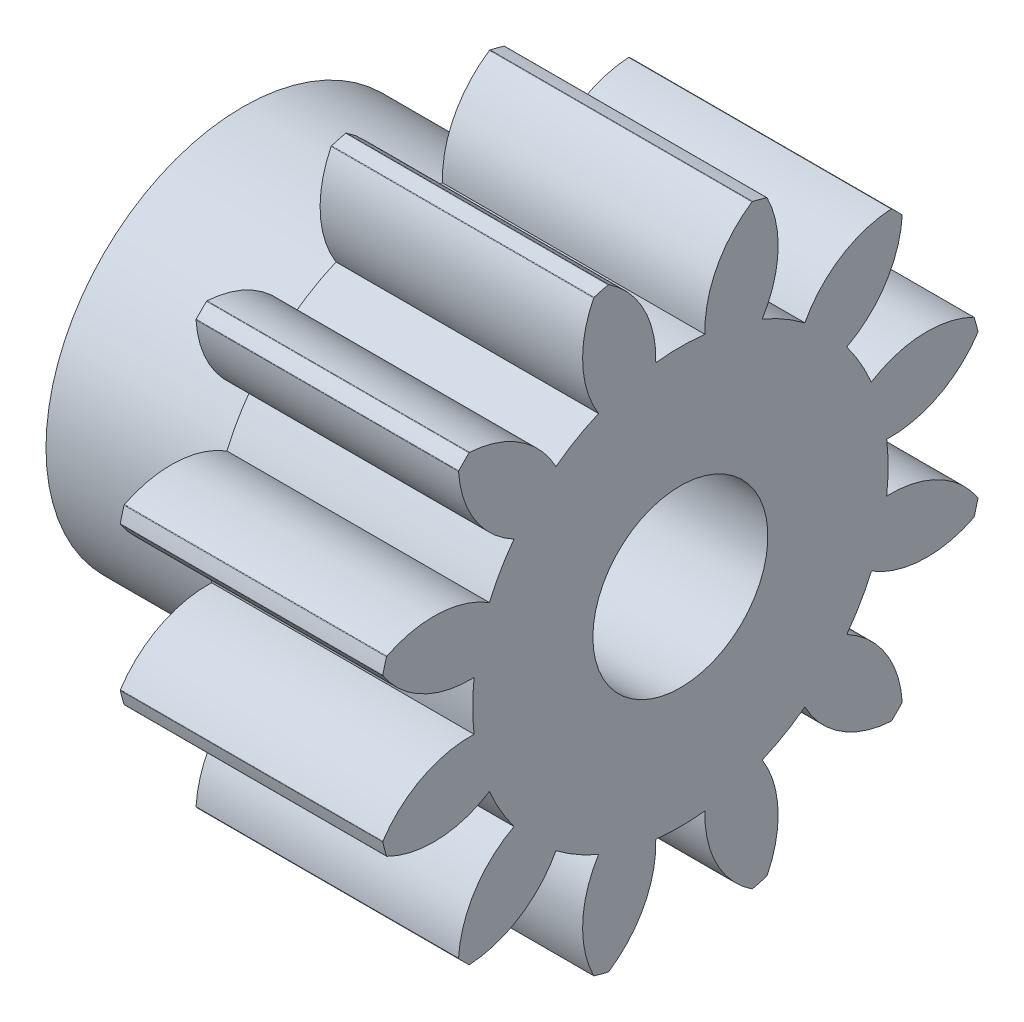
from build123d import *

# Parameters (mm, degrees)
BASPROSKE_W           = 6
BASPROSKE_H           = 7
TOOTHCUT_DEPTH        = 12.575836903
BREAKS_R              = 0.02
TEETHCUTS_COUNT       = 12
BREAKS_OF_TEETHCUTS_R = 0.02
BORSKE_R              = 2
BORE_DEPTH            = 50.0000508
SKETCH_3_R            = 4.5
EXTRUDE_2_DEPTH       = 4


with BuildPart() as part:
    # BasProSke → Base-Revolve (revolve)
    with BuildSketch(Plane(origin=(0, 0, 0), x_dir=(1, 0, 0), z_dir=(0, 1, 0))):
        with Locations((3, 3.5)):
            Rectangle(BASPROSKE_W, BASPROSKE_H)
    revolve(axis=Axis((-10, 0, 0), (1, 0, 0)))

    # TooCutSke → ToothCut (cut, through all)
    with BuildSketch(Plane(origin=(0, 0, 0), x_dir=(0, 0, -1), z_dir=(1, 0, 0))):
        with BuildLine():
            ThreePointArc((0.562207301, 4.715604304), (0, 4.749), (-0.562207301, 4.715604304))
            ThreePointArc((-0.562207301, 4.715604304), (-0.837528627, 5.917009812), (-1.672850686, 6.823328788))
            ThreePointArc((-1.672850686, 6.823328788), (0, 7.0254), (1.672850686, 6.823328788))
            ThreePointArc((1.672850686, 6.823328788), (0.837528627, 5.917009812), (0.562207301, 4.715604304))
        make_face()
    toothcut = extrude(amount=TOOTHCUT_DEPTH, mode=Mode.SUBTRACT)

    # Breaks
    breaks_edges = [part.edges().sort_by_distance(p)[0] for p in [
        (3, 6.804338411, -1.643465482),
        (3, 6.804338411, 1.643465482),
    ]]
    fillet(breaks_edges, radius=BREAKS_R)

    # TeethCuts: ToothCut ×12 about axis
    teethcuts_axis = Axis((-10, 0, 0), (1, 0, 0))
    for i in range(1, TEETHCUTS_COUNT):
        add(toothcut.rotate(teethcuts_axis, i * 360 / TEETHCUTS_COUNT), mode=Mode.SUBTRACT)

    # Breaks of TeethCuts
    breaks_of_teethcuts_edges = [part.edges().sort_by_distance(p)[0] for p in [
        (3, 6.714462661, 1.978886348),
        (3, 5.070997179, 4.825452063),
        (3, 4.825452063, 5.070997179),
        (3, 1.978886348, 6.714462661),
        (3, 1.643465482, 6.804338411),
        (3, -1.643465482, 6.804338411),
        (3, -1.978886348, 6.714462661),
        (3, -4.825452063, 5.070997179),
        (3, -5.070997179, 4.825452063),
        (3, -6.714462661, 1.978886348),
        (3, -6.804338411, 1.643465482),
        (3, -6.804338411, -1.643465482),
        (3, -6.714462661, -1.978886348),
        (3, -5.070997179, -4.825452063),
        (3, -4.825452063, -5.070997179),
        (3, -1.978886348, -6.714462661),
        (3, -1.643465482, -6.804338411),
        (3, 1.643465482, -6.804338411),
        (3, 1.978886348, -6.714462661),
        (3, 4.825452063, -5.070997179),
        (3, 5.070997179, -4.825452063),
        (3, 6.714462661, -1.978886348),
    ]]
    fillet(breaks_of_teethcuts_edges, radius=BREAKS_OF_TEETHCUTS_R)

    # BorSke → Bore (cut, symmetric)
    with BuildSketch(Plane(origin=(0, 0, 0), x_dir=(0, 0, -1), z_dir=(1, 0, 0))):
        Circle(BORSKE_R)
    extrude(amount=BORE_DEPTH, both=True, mode=Mode.SUBTRACT)


with BuildPart() as body_2:
    # Эскиз3 → Бобышка-Вытянуть2 (new body)
    with BuildSketch(Plane.ZY.offset(4)):
        Circle(SKETCH_3_R)
        with BuildLine():
            ThreePointArc((-0.876147315, 2.018010377), (-0.823286315, 2.040146966), (-0.769866652, 2.060899158))
            Line((-0.769866652, 2.060899158), (-0.723029135, 2.393162943))
            ThreePointArc((-0.723029135, 2.393162943), (-0.561364767, 2.436158779), (-0.397186922, 2.468246857))
            Line((-0.397186922, 2.468246857), (-0.209666112, 2.189986329))
            ThreePointArc((-0.209666112, 2.189986329), (-0.152551731, 2.194704529), (-0.095333833, 2.197933452))
            Line((-0.095333833, 2.197933452), (0.051886449, 2.499461501))
            ThreePointArc((0.051886449, 2.499461501), (0.218924844, 2.490395935), (0.384983015, 2.470179766))
            Line((0.384983015, 2.470179766), (0.477338671, 2.147591161))
            ThreePointArc((0.477338671, 2.147591161), (0.533115679, 2.134429121), (0.588530927, 2.119818707))
            Line((0.588530927, 2.119818707), (0.821723026, 2.361095353))
            ThreePointArc((0.821723026, 2.361095353), (0.977784566, 2.300855785), (1.129468132, 2.230314269))
            Line((1.129468132, 2.230314269), (1.117618219, 1.894974806))
            ThreePointArc((1.117618219, 1.894974806), (1.166598012, 1.865220919), (1.214786178, 1.834201336))
            Line((1.214786178, 1.834201336), (1.511123628, 1.991608742))
            ThreePointArc((1.511123628, 1.991608742), (1.640931922, 1.88609184), (1.763393039, 1.772130071))
            Line((1.763393039, 1.772130071), (1.648497509, 1.456865115))
            ThreePointArc((1.648497509, 1.456865115), (1.685885604, 1.413431898), (1.722129695, 1.369039559))
            Line((1.722129695, 1.369039559), (2.052604921, 1.42716959))
            ThreePointArc((2.052604921, 1.42716959), (2.143453429, 1.286704084), (2.224704749, 1.140477435))
            Line((2.224704749, 1.140477435), (2.018010377, 0.876147315))
            ThreePointArc((2.018010377, 0.876147315), (2.040146966, 0.823286315), (2.060899158, 0.769866652))
            Line((2.060899158, 0.769866652), (2.393162943, 0.723029135))
            ThreePointArc((2.393162943, 0.723029135), (2.436158779, 0.561364767), (2.468246857, 0.397186922))
            Line((2.468246857, 0.397186922), (2.189986329, 0.209666112))
            ThreePointArc((2.189986329, 0.209666112), (2.194704529, 0.152551731), (2.197933452, 0.095333833))
            Line((2.197933452, 0.095333833), (2.499461501, -0.051886449))
            ThreePointArc((2.499461501, -0.051886449), (2.490395935, -0.218924844), (2.470179766, -0.384983015))
            Line((2.470179766, -0.384983015), (2.147591161, -0.477338671))
            ThreePointArc((2.147591161, -0.477338671), (2.134429121, -0.533115679), (2.119818707, -0.588530927))
            Line((2.119818707, -0.588530927), (2.361095353, -0.821723026))
            ThreePointArc((2.361095353, -0.821723026), (2.300855785, -0.977784566), (2.230314269, -1.129468132))
            Line((2.230314269, -1.129468132), (1.894974806, -1.117618219))
            ThreePointArc((1.894974806, -1.117618219), (1.865220919, -1.166598012), (1.834201336, -1.214786178))
            Line((1.834201336, -1.214786178), (1.991608742, -1.511123628))
            ThreePointArc((1.991608742, -1.511123628), (1.88609184, -1.640931922), (1.772130071, -1.763393039))
            Line((1.772130071, -1.763393039), (1.456865115, -1.648497509))
            ThreePointArc((1.456865115, -1.648497509), (1.413431898, -1.685885604), (1.369039559, -1.722129695))
            Line((1.369039559, -1.722129695), (1.42716959, -2.052604921))
            ThreePointArc((1.42716959, -2.052604921), (1.286704084, -2.143453429), (1.140477435, -2.224704749))
            Line((1.140477435, -2.224704749), (0.876147315, -2.018010377))
            ThreePointArc((0.876147315, -2.018010377), (0.823286315, -2.040146966), (0.769866652, -2.060899158))
            Line((0.769866652, -2.060899158), (0.723029135, -2.393162943))
            ThreePointArc((0.723029135, -2.393162943), (0.561364767, -2.436158779), (0.397186922, -2.468246857))
            Line((0.397186922, -2.468246857), (0.209666112, -2.189986329))
            ThreePointArc((0.209666112, -2.189986329), (0.152551731, -2.194704529), (0.095333833, -2.197933452))
            Line((0.095333833, -2.197933452), (-0.051886449, -2.499461501))
            ThreePointArc((-0.051886449, -2.499461501), (-0.218924844, -2.490395935), (-0.384983015, -2.470179766))
            Line((-0.384983015, -2.470179766), (-0.477338671, -2.147591161))
            ThreePointArc((-0.477338671, -2.147591161), (-0.533115679, -2.134429121), (-0.588530927, -2.119818707))
            Line((-0.588530927, -2.119818707), (-0.821723026, -2.361095353))
            ThreePointArc((-0.821723026, -2.361095353), (-0.977784566, -2.300855785), (-1.129468132, -2.230314269))
            Line((-1.129468132, -2.230314269), (-1.117618219, -1.894974806))
            ThreePointArc((-1.117618219, -1.894974806), (-1.166598012, -1.865220919), (-1.214786178, -1.834201336))
            Line((-1.214786178, -1.834201336), (-1.511123628, -1.991608742))
            ThreePointArc((-1.511123628, -1.991608742), (-1.640931922, -1.88609184), (-1.763393039, -1.772130071))
            Line((-1.763393039, -1.772130071), (-1.648497509, -1.456865115))
            ThreePointArc((-1.648497509, -1.456865115), (-1.685885604, -1.413431898), (-1.722129695, -1.369039559))
            Line((-1.722129695, -1.369039559), (-2.052604921, -1.42716959))
            ThreePointArc((-2.052604921, -1.42716959), (-2.143453429, -1.286704084), (-2.224704749, -1.140477435))
            Line((-2.224704749, -1.140477435), (-2.018010377, -0.876147315))
            ThreePointArc((-2.018010377, -0.876147315), (-2.040146966, -0.823286315), (-2.060899158, -0.769866652))
            Line((-2.060899158, -0.769866652), (-2.393162943, -0.723029135))
            ThreePointArc((-2.393162943, -0.723029135), (-2.436158779, -0.561364767), (-2.468246857, -0.397186922))
            Line((-2.468246857, -0.397186922), (-2.189986329, -0.209666112))
            ThreePointArc((-2.189986329, -0.209666112), (-2.194704529, -0.152551731), (-2.197933452, -0.095333833))
            Line((-2.197933452, -0.095333833), (-2.499461501, 0.051886449))
            ThreePointArc((-2.499461501, 0.051886449), (-2.490395935, 0.218924844), (-2.470179766, 0.384983015))
            Line((-2.470179766, 0.384983015), (-2.147591161, 0.477338671))
            ThreePointArc((-2.147591161, 0.477338671), (-2.134429121, 0.533115679), (-2.119818707, 0.588530927))
            Line((-2.119818707, 0.588530927), (-2.361095353, 0.821723026))
            ThreePointArc((-2.361095353, 0.821723026), (-2.300855785, 0.977784566), (-2.230314269, 1.129468132))
            Line((-2.230314269, 1.129468132), (-1.894974806, 1.117618219))
            ThreePointArc((-1.894974806, 1.117618219), (-1.865220919, 1.166598012), (-1.834201336, 1.214786178))
            Line((-1.834201336, 1.214786178), (-1.991608742, 1.511123628))
            ThreePointArc((-1.991608742, 1.511123628), (-1.88609184, 1.640931922), (-1.772130071, 1.763393039))
            Line((-1.772130071, 1.763393039), (-1.456865115, 1.648497509))
            ThreePointArc((-1.456865115, 1.648497509), (-1.413431898, 1.685885604), (-1.369039559, 1.722129695))
            Line((-1.369039559, 1.722129695), (-1.42716959, 2.052604921))
            ThreePointArc((-1.42716959, 2.052604921), (-1.286704084, 2.143453429), (-1.140477435, 2.224704749))
            Line((-1.140477435, 2.224704749), (-0.876147315, 2.018010377))
        make_face(mode=Mode.SUBTRACT)
    extrude(amount=-EXTRUDE_2_DEPTH)


solid = Compound([part.part, body_2.part])
